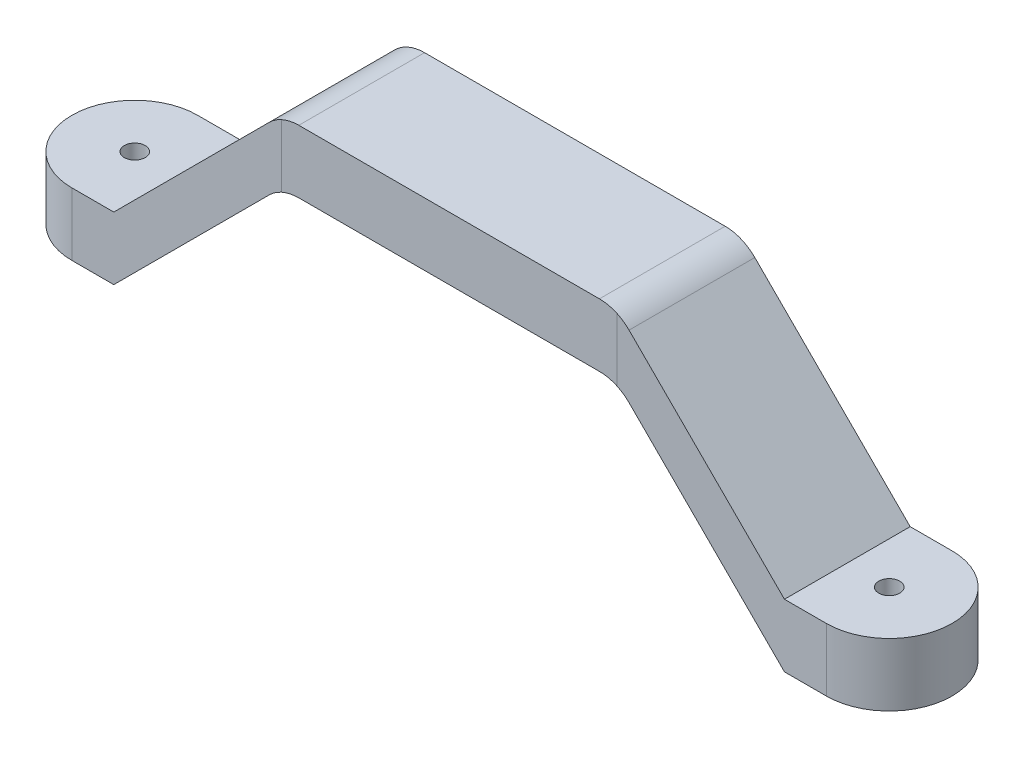
from build123d import *

# Parameters (mm, degrees)
SWEEP1_START        = -19.05
SWEEP1_DEPTH        = 38.1
BOSS_EXTRUDE1_START = -9.525
SKETCH4_R           = 3.175
BOSS_EXTRUDE1_DEPTH = 19.05
FILLET1_R           = 12.7


# Read off the part's stored shape, not the designer's step: Sweep1
with BuildPart() as part:
    # Sweep1 outline → Sweep1 (new body)
    with BuildSketch(Plane.XY.offset(SWEEP1_START)):
        Polygon((101.6, 41.275), (101.6, 60.325), (50.8, 60.325), (0, 9.525), (0, -9.525), (50.8, 41.275), align=None)
    extrude(amount=SWEEP1_DEPTH)

    # Sketch4 → Boss-Extrude1 (add)
    with BuildSketch(Plane(origin=(0, 0, 0), x_dir=(1, 0, 0), z_dir=(0, 1, 0)).offset(BOSS_EXTRUDE1_START)):
        with BuildLine():
            Line((0, 19.05), (-12.7, 19.05))
            ThreePointArc((-12.7, 19.05), (-31.75, 0), (-12.7, -19.05))
            Line((-12.7, -19.05), (0, -19.05))
            Line((0, -19.05), (0, 19.05))
        make_face()
        with Locations(Location((-12.7, 0, 0), (0, 0, 90))):
            Circle(SKETCH4_R, mode=Mode.SUBTRACT)
    extrude(amount=BOSS_EXTRUDE1_DEPTH)

    # Mirror4: part across plane


with BuildPart() as part_1:
    add(part.part)
    add(part.part.mirror(Plane(origin=(101.6, 0, 0), x_dir=(0, 0, 1), z_dir=(1, 0, 0))))

    # Fillet1
    fillet1_edges = [part_1.edges().sort_by_distance(p)[0] for p in [
        (50.8, 60.325, 0),
        (50.8, 41.275, 0),
        (152.4, 60.325, 0),
        (152.4, 41.275, 0),
    ]]
    fillet(fillet1_edges, radius=FILLET1_R)


solid = part_1.part
